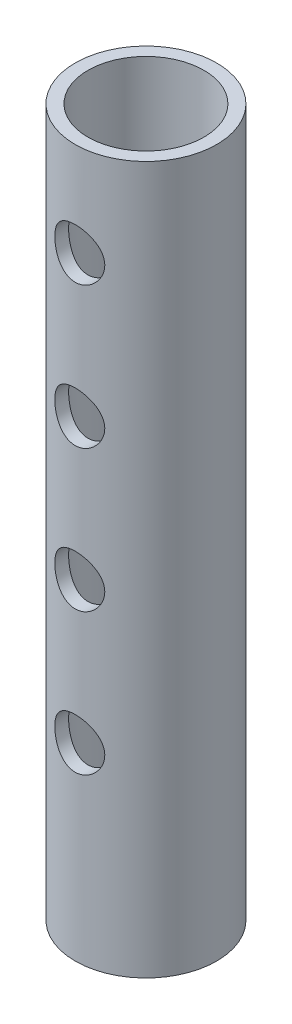
from build123d import *

# Parameters (mm, degrees)
SKETCH_1_R               = 7.5
SKETCH_1_R_2             = 6.15
EXTRUDE_1_DEPTH          = 75
CUT_EXTRUDE_1_DEPTH      = 76.746287038
CUT_EXTRUDE_1_DEPTH_BACK = 76.746287038
SKETCH_3_R               = 2.65


with BuildPart() as part:
    # 草图1 → 凸台-拉伸1 (new body)
    with BuildSketch(Plane(origin=(0, 0, 0), x_dir=(1, 0, 0), z_dir=(0, 1, 0))):
        Circle(SKETCH_1_R)
        Circle(SKETCH_1_R_2, mode=Mode.SUBTRACT)
    extrude(amount=EXTRUDE_1_DEPTH)

    # 草图3 → 切除-拉伸1 (cut, two sides: drawn at the far end of the back side and taken through both)
    with BuildSketch(Plane.XY.offset(-CUT_EXTRUDE_1_DEPTH_BACK)):
        with Locations((0, 20)):
            Circle(SKETCH_3_R)
        with Locations((0, 35)):
            Circle(SKETCH_3_R)
        with Locations((0, 50)):
            Circle(SKETCH_3_R)
        with Locations((0, 65)):
            Circle(SKETCH_3_R)
    extrude(amount=CUT_EXTRUDE_1_DEPTH + CUT_EXTRUDE_1_DEPTH_BACK, mode=Mode.SUBTRACT)


solid = part.part
